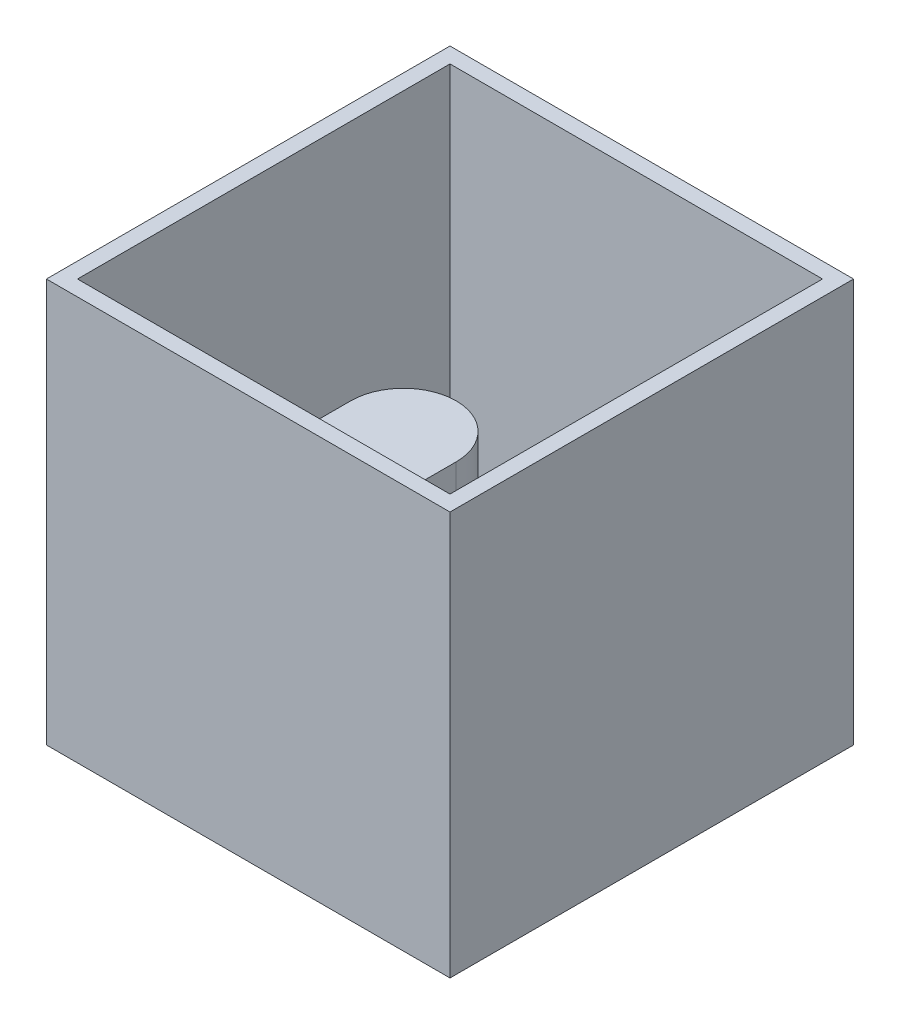
from build123d import *

# Parameters (mm, degrees)
SKETCH1_W           = 13
SKETCH1_H           = 13
SKETCH1_W_2         = 12
SKETCH1_H_2         = 12
BOSS_EXTRUDE1_DEPTH = 13
SKETCH1_4_W         = 12
SKETCH1_4_H         = 12
SKETCH1_4_W_2       = 6
SKETCH1_4_H_2       = 8
SKETCH1_4_W_3       = 4
SKETCH1_4_H_3       = 1.754040625
BOSS_EXTRUDE2_DEPTH = 1
SKETCH1_7_W         = 6
SKETCH1_7_H         = 8
SKETCH1_7_W_2       = 4
SKETCH1_7_H_2       = 1.754040625
CUT_EXTRUDE1_DEPTH  = 1
FILLET1_R           = 3
SKETCH3_W           = 0.743374663
SKETCH3_H           = 1.154040625
SKETCH3_W_2         = 0.3
BOSS_EXTRUDE3_DEPTH = 1
FILLET2_R           = 20
BOSS_EXTRUDE4_DEPTH = 6


# Some blends are built 0.0001 mm under size
with BuildPart() as part:
    # Sketch1 → Boss-Extrude1 (new body)
    with BuildSketch(Plane(origin=(0, 0, 0), x_dir=(1, 0, 0), z_dir=(0, 1, 0))):
        with Locations((5, -6.841440964)):
            Rectangle(SKETCH1_W, SKETCH1_H)
        with Locations((5, -6.841440964)):
            Rectangle(SKETCH1_W_2, SKETCH1_H_2, mode=Mode.SUBTRACT)
    extrude(amount=BOSS_EXTRUDE1_DEPTH)

    # Sketch1<4> → Boss-Extrude2 (add)
    # profile 1 of 3: a face of its own
    with BuildSketch(Plane(origin=(0, 0, 0), x_dir=(1, 0, 0), z_dir=(0, 1, 0))):
        with Locations((5, -6.841440964)):
            Rectangle(SKETCH1_4_W, SKETCH1_4_H)
        Polygon((-0.500000048, -10.841440964), (-0.500000048, -2.841440964), (5.499999952, -2.841440964), (5.499999952, -5.84487475), (9.499999952, -5.84487475), (9.499999952, -7.598915375), (5.499999952, -7.598915375), (5.499999952, -10.841440964), align=None, mode=Mode.SUBTRACT)
    # profile 2 of 3: a face of its own
    with BuildSketch(Plane(origin=(0, 0, 0), x_dir=(1, 0, 0), z_dir=(0, 1, 0))):
        with Locations((2.499999952, -6.841440964)):
            Rectangle(SKETCH1_4_W_2, SKETCH1_4_H_2)
    # profile 3 of 3: a face of its own
    with BuildSketch(Plane(origin=(0, 0, 0), x_dir=(1, 0, 0), z_dir=(0, 1, 0))):
        with Locations((7.499999952, -6.721895063)):
            Rectangle(SKETCH1_4_W_3, SKETCH1_4_H_3)
    extrude(amount=BOSS_EXTRUDE2_DEPTH)

    # Sketch1<7> → Cut-Extrude1 (cut)
    with BuildSketch(Plane(origin=(0, 0, 0), x_dir=(1, 0, 0), z_dir=(0, 1, 0))):
        with Locations((2.499999952, -6.841440964)):
            Rectangle(SKETCH1_7_W, SKETCH1_7_H)
        with Locations((7.499999952, -6.721895063)):
            Rectangle(SKETCH1_7_W_2, SKETCH1_7_H_2)
    extrude(amount=CUT_EXTRUDE1_DEPTH, mode=Mode.SUBTRACT)

    # Fillet1
    fillet1_edges = [part.edges().sort_by_distance(p)[0] for p in [
        (5.499999952, 0.5, 2.841440964),
        (-0.500000048, 0.5, 2.841440964),
        (-0.500000048, 0.5, 10.841440964),
        (5.499999952, 0.5, 10.841440964),
    ]]
    fillet(fillet1_edges, radius=FILLET1_R - 0.0001)  # a hair under: the kernel refuses the full size

    # Sketch3 → Boss-Extrude3 (add)
    with BuildSketch(Plane.XZ):
        with Locations((9.871687284, 6.721895063)):
            Rectangle(SKETCH3_W, SKETCH3_H)
        with BuildLine():
            Line((5.199999952, 7.298915375), (5.199999952, 7.841440964))
            ThreePointArc((5.199999952, 7.841440964), (4.409188261, 9.750629273), (2.499999952, 10.541440964))
            ThreePointArc((2.499999952, 10.541440964), (0.590811643, 9.750629273), (-0.200000048, 7.841440964))
            Line((-0.200000048, 7.841440964), (-0.200000048, 5.841440964))
            ThreePointArc((-0.200000048, 5.841440964), (0.590811643, 3.932252654), (2.499999952, 3.141440964))
            ThreePointArc((2.499999952, 3.141440964), (4.409188261, 3.932252654), (5.199999952, 5.841440964))
            Line((5.199999952, 5.841440964), (5.199999952, 6.14487475))
            Line((5.199999952, 6.14487475), (9.199999952, 6.14487475))
            Line((9.199999952, 6.14487475), (9.199999952, 7.298915375))
            Line((9.199999952, 7.298915375), (5.199999952, 7.298915375))
        make_face()
        with Locations((9.349999952, 6.721895063)):
            Rectangle(SKETCH3_W_2, SKETCH3_H)
    extrude(amount=-BOSS_EXTRUDE3_DEPTH)

    # Fillet2
    # the kernel refuses this fillet: 20 mm, written as the material it adds along each edge
    with BuildSketch(Plane(origin=(9.499999952, 0, 7.298915375), x_dir=(0, 0, 1), z_dir=(0, 1, 0)), Plane(origin=(9.499999952, 1, 6.14487475), x_dir=(0, 0, -1), z_dir=(0, -1, 0))) as fillet2_piece_1:
        with BuildLine():
            CenterArc((20, -3.451086785), FILLET2_R, 170.063632928, 9.936367072)
            Line((0, -3.451086785), (0, 0))
            Line((0, 0), (0.3, 0))
        make_face()
    extrude(amount=1)

    # Sketch4 → Boss-Extrude4 (add)
    with BuildSketch(Plane(origin=(0, 1, 0), x_dir=(1, 0, 0), z_dir=(0, 1, 0))):
        with BuildLine():
            Line((4.199999952, -5.841440964), (4.199999952, -7.841440964))
            ThreePointArc((4.199999952, -7.841440964), (2.499999952, -9.541440964), (0.799999952, -7.841440964))
            Line((0.799999952, -7.841440964), (0.799999952, -5.841440964))
            ThreePointArc((0.799999952, -5.841440964), (2.499999952, -4.141440964), (4.199999952, -5.841440964))
        make_face()
    extrude(amount=BOSS_EXTRUDE4_DEPTH)


solid = part.part
